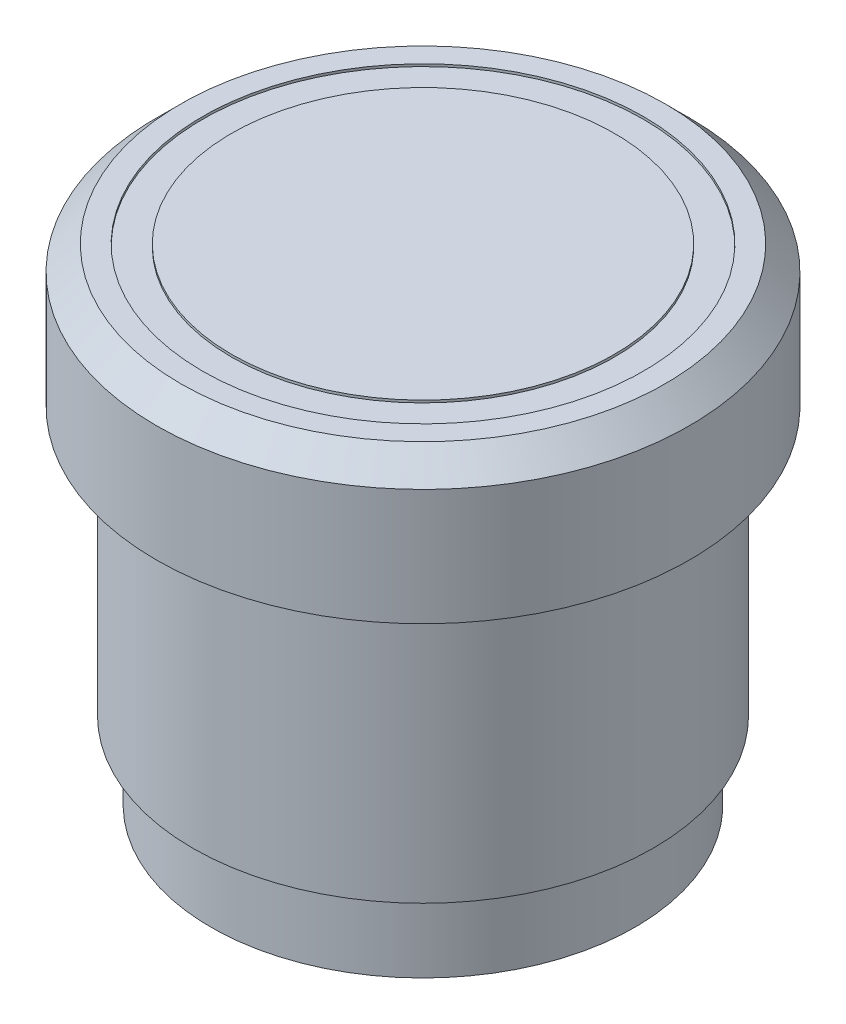
from build123d import *

# Parameters (mm, degrees)
SKETCH2_R          = 9.1
SKETCH2_R_2        = 7.9
CUT_EXTRUDE1_DEPTH = 0.1
CHAMFER1_SIZE      = 1


with BuildPart() as part:
    # Sketch1 → Revolve1 (revolve)
    with BuildSketch(Plane(origin=(0, 0, 0), x_dir=(0, 0, -1), z_dir=(1, 0, 0))):
        Polygon((0, 20.05), (11, 20.05), (11, 14.25), (9.5, 14.25), (9.5, 3.2), (8.75, 3.2), (8.75, 0), (0, 0), align=None)
    revolve(axis=Axis((0, 0, 0), (0, 1, 0)))

    # Sketch2 → Cut-Extrude1 (cut)
    with BuildSketch(Plane(origin=(0, 20.05, 0), x_dir=(1, 0, 0), z_dir=(0, 1, 0))):
        Circle(SKETCH2_R)
        Circle(SKETCH2_R_2, mode=Mode.SUBTRACT)
    extrude(amount=-CUT_EXTRUDE1_DEPTH, mode=Mode.SUBTRACT)

    # Chamfer1
    chamfer1_edges = [part.edges().sort_by_distance(p)[0] for p in [
        (0, 20.05, 11),
    ]]
    chamfer(chamfer1_edges, length=CHAMFER1_SIZE)


solid = part.part
